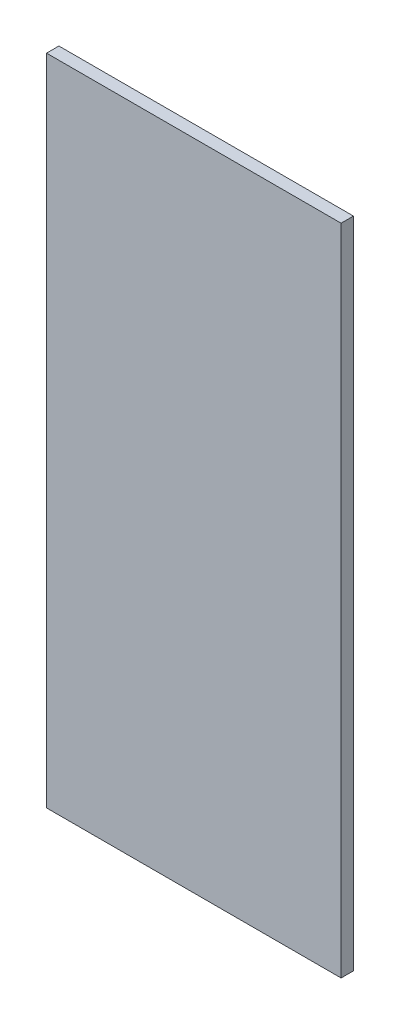
from build123d import *

# Parameters (mm, degrees)
SKETCH1_W           = 143
SKETCH1_H           = 317.37
BOSS_EXTRUDE1_DEPTH = 6


with BuildPart() as part:
    # Sketch1 → Boss-Extrude1 (new body)
    with BuildSketch(Plane.XY):
        Rectangle(SKETCH1_W, SKETCH1_H)
    extrude(amount=BOSS_EXTRUDE1_DEPTH)


solid = part.part
